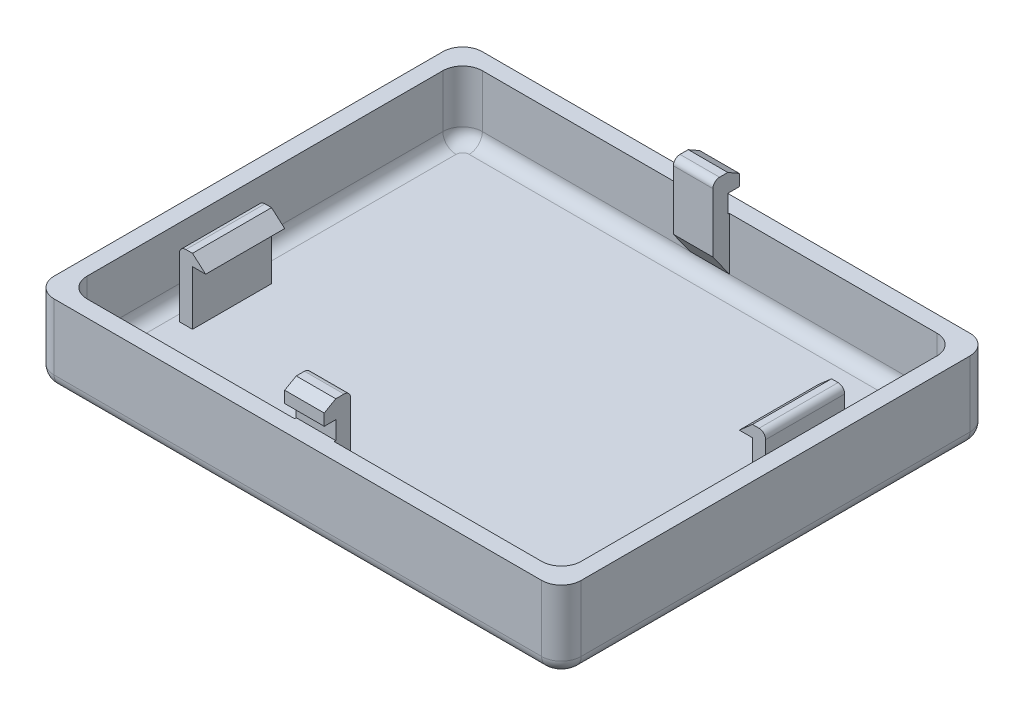
from build123d import *

# Parameters (mm, degrees)
SKETCH1_W            = 80
SKETCH1_H            = 65
BOSS_EXTRUDE1_DEPTH  = 12
SKETCH2_W            = 75
SKETCH2_H            = 60
CUT_EXTRUDE1_DEPTH   = 10
FILLET4_R            = 2
FILLET5_R            = 3
FILLET8_R            = 2
SKETCH5_W            = 6
SKETCH5_H            = 13.5
BOSS_EXTRUDE2_DEPTH  = 2.5
CUT_EXTRUDE3_REACH   = 81.876
SKETCH6_W            = 0.25
SKETCH6_H            = 5.5
BOSS_EXTRUDE3_DEPTH  = 6
CUT_EXTRUDE4_REACH   = 81.876
SKETCH10_W           = 6
SKETCH10_H           = 13.5
BOSS_EXTRUDE4_DEPTH  = 2.5
CUT_EXTRUDE5_REACH   = 81.876
SKETCH11_W           = 0.25
SKETCH11_H           = 5.5
BOSS_EXTRUDE5_DEPTH  = 6
CUT_EXTRUDE6_DEPTH   = 6
SKETCH14_W           = 2
SKETCH14_H           = 12
BOSS_EXTRUDE7_DEPTH  = 10
SKETCH15_W           = 12
SKETCH15_H           = 1.75
BOSS_EXTRUDE8_DEPTH  = 2
SKETCH16_W           = 2
SKETCH16_H           = 12
BOSS_EXTRUDE9_DEPTH  = 10
SKETCH17_W           = 12
SKETCH17_H           = 1.75
BOSS_EXTRUDE10_DEPTH = 2
FILLET9_R            = 1
CUT_EXTRUDE7_REACH   = 97.176
CUT_EXTRUDE8_REACH   = 91.658


with BuildPart() as part:
    # Sketch1 → Boss-Extrude1 (new body)
    with BuildSketch(Plane(origin=(0, 0, 0), x_dir=(1, 0, 0), z_dir=(0, 1, 0))):
        with Locations((40, 32.5)):
            Rectangle(SKETCH1_W, SKETCH1_H)
    extrude(amount=BOSS_EXTRUDE1_DEPTH)

    # Sketch2 → Cut-Extrude1 (cut)
    with BuildSketch(Plane(origin=(0, 12, 0), x_dir=(1, 0, 0), z_dir=(0, 1, 0))):
        with Locations((40, 32.5)):
            Rectangle(SKETCH2_W, SKETCH2_H)
    extrude(amount=-CUT_EXTRUDE1_DEPTH, mode=Mode.SUBTRACT)

    # Fillet4
    fillet4_edges = [part.edges().sort_by_distance(p)[0] for p in [
        (40, 0, -65),
        (80, 0, -32.5),
        (40, 0, 0),
        (0, 0, -32.5),
    ]]
    fillet(fillet4_edges, radius=FILLET4_R)

    # Fillet5
    # the kernel refuses this fillet: 3 mm, written as the material it adds along each edge
    with BuildSketch(Plane(origin=(2.5, 12, -2.5), x_dir=(0, 0, -1), z_dir=(0, -1, 0)), Plane(origin=(77.5, 12, -62.5), x_dir=(0, 0, 1), z_dir=(0, -1, 0)), Plane(origin=(77.5, 12, -2.5), x_dir=(-1, 0, 0), z_dir=(0, -1, 0))) as fillet5_piece_1:
        with BuildLine():
            CenterArc((FILLET5_R, FILLET5_R), FILLET5_R, 180, 90)
            Line((0, FILLET5_R), (0, 0))
            Line((0, 0), (FILLET5_R, 0))
        make_face()
    extrude(amount=10)
    with BuildSketch(Plane(origin=(2.5, 12, -62.5), x_dir=(0, 0, 1), z_dir=(0, -1, 0))) as fillet5_piece_2:
        with BuildLine():
            CenterArc((FILLET5_R, -FILLET5_R), FILLET5_R, 90, 90)
            Line((0, -FILLET5_R), (0, 0))
            Line((0, 0), (FILLET5_R, 0))
        make_face()
    extrude(amount=10)
    # the kernel refuses this fillet: 3 mm, written as the material it takes off along each edge
    with BuildSketch(Plane(origin=(77, 0, -62), x_dir=(0, 0, -1), z_dir=(-1, 0, 0))) as fillet5_2_piece_1:
        with BuildLine():
            CenterArc((1, -2), 2, 0, 90)
            Line((3, -2), (3, 0))
            Line((3, 0), (1, 0))
        make_face()
    revolve(axis=Axis((77, 0, -62), (0, -1, 0)), revolution_arc=90, mode=Mode.SUBTRACT)
    with BuildSketch(Plane(origin=(77, 0, -3), x_dir=(1, 0, 0), z_dir=(0, 0, -1))) as fillet5_2_piece_2:
        with BuildLine():
            CenterArc((1, -2), 2, 0, 90)
            Line((3, -2), (3, 0))
            Line((3, 0), (1, 0))
        make_face()
    revolve(axis=Axis((77, 0, -3), (0, -1, 0)), revolution_arc=90, mode=Mode.SUBTRACT)
    with BuildSketch(Plane(origin=(3, 0, -62), x_dir=(-1, 0, 0), z_dir=(0, 0, 1))) as fillet5_2_piece_3:
        with BuildLine():
            CenterArc((1, -2), 2, 0, 90)
            Line((3, -2), (3, 0))
            Line((3, 0), (1, 0))
        make_face()
    revolve(axis=Axis((3, 0, -62), (0, -1, 0)), revolution_arc=90, mode=Mode.SUBTRACT)
    with BuildSketch(Plane(origin=(3, 0, -3), x_dir=(0, 0, 1), z_dir=(1, 0, 0))) as fillet5_2_piece_4:
        with BuildLine():
            CenterArc((1, -2), 2, 0, 90)
            Line((3, -2), (3, 0))
            Line((3, 0), (1, 0))
        make_face()
    revolve(axis=Axis((3, 0, -3), (0, -1, 0)), revolution_arc=90, mode=Mode.SUBTRACT)
    with BuildSketch(Plane(origin=(0, 0, -65), x_dir=(0, 0, 1), z_dir=(0, 1, 0)), Plane(origin=(0, 0, 0), x_dir=(1, 0, 0), z_dir=(0, 1, 0))) as fillet5_2_piece_5:
        with BuildLine():
            CenterArc((FILLET5_R, FILLET5_R), FILLET5_R, 180, 90)
            Line((0, FILLET5_R), (0, 0))
            Line((0, 0), (FILLET5_R, 0))
        make_face()
    extrude(amount=19.5, mode=Mode.SUBTRACT)
    with BuildSketch(Plane(origin=(80, 0, -65), x_dir=(0, 0, 1), z_dir=(0, 1, 0)), Plane(origin=(80, 0, 0), x_dir=(-1, 0, 0), z_dir=(0, 1, 0))) as fillet5_2_piece_6:
        with BuildLine():
            CenterArc((FILLET5_R, -FILLET5_R), FILLET5_R, 90, 90)
            Line((0, -FILLET5_R), (0, 0))
            Line((0, 0), (FILLET5_R, 0))
        make_face()
    extrude(amount=19.5, mode=Mode.SUBTRACT)

    # Fillet8
    fillet8_edges = [part.edges().sort_by_distance(p)[0] for p in [
        (40, 2, -2.5),
        (2.5, 2, -32.5),
        (77.5, 2, -32.5),
        (40, 2, -62.5),
        (3.378679656, 2, -61.621320344),
        (76.621320344, 2, -61.621320344),
        (76.621320344, 2, -3.378679656),
        (3.378679656, 2, -3.378679656),
    ]]
    fillet(fillet8_edges, radius=FILLET8_R)

    # Sketch5 → Boss-Extrude2 (add)
    with BuildSketch(Plane.XY.offset(-62.5)):
        with Locations((40, 10.75)):
            Rectangle(SKETCH5_W, SKETCH5_H)
    extrude(amount=BOSS_EXTRUDE2_DEPTH)

    # Sketch6 → Cut-Extrude3 (cut, up to next)
    with BuildSketch(Plane(origin=(43, 0, 0), x_dir=(0, 0, -1), z_dir=(1, 0, 0)), mode=Mode.PRIVATE) as cut_extrude3_sk1:
        with Locations((62.375, 14.75)):
            Rectangle(SKETCH6_W, SKETCH6_H)
    cut_extrude3_tool1 = extrude(cut_extrude3_sk1.sketch, amount=-CUT_EXTRUDE3_REACH, mode=Mode.PRIVATE) & part.part
    add(cut_extrude3_tool1.solids().sort_by_distance((43, 14.75, -62.375))[0], mode=Mode.SUBTRACT)

    # Sketch7 → Boss-Extrude3 (add)
    with BuildSketch(Plane(origin=(43, 0, 0), x_dir=(0, 0, -1), z_dir=(1, 0, 0))):
        Polygon((62.25, 14.75), (64, 14.75), (64, 16.5), (62.25, 17.5), align=None)
    extrude(amount=-BOSS_EXTRUDE3_DEPTH)

    # Sketch8 → Cut-Extrude4 (cut, up to next)
    with BuildSketch(Plane(origin=(43, 0, 0), x_dir=(0, 0, -1), z_dir=(1, 0, 0)), mode=Mode.PRIVATE) as cut_extrude4_sk1:
        Polygon((60, 4), (62.5, 4), (60, 7.5), align=None)
    cut_extrude4_tool1 = extrude(cut_extrude4_sk1.sketch, amount=-CUT_EXTRUDE4_REACH, mode=Mode.PRIVATE) & part.part
    add(cut_extrude4_tool1.solids().sort_by_distance((43, 5.166667, -60.833333))[0], mode=Mode.SUBTRACT)

    # Sketch10 → Boss-Extrude4 (add)
    with BuildSketch(Plane(origin=(0, 0, -2.5), x_dir=(-1, 0, 0), z_dir=(0, 0, -1))):
        with Locations((-40, 10.75)):
            Rectangle(SKETCH10_W, SKETCH10_H)
    extrude(amount=BOSS_EXTRUDE4_DEPTH)

    # Sketch11 → Cut-Extrude5 (cut, up to next)
    with BuildSketch(Plane.ZY.offset(-37), mode=Mode.PRIVATE) as cut_extrude5_sk1:
        with Locations((-2.625, 14.75)):
            Rectangle(SKETCH11_W, SKETCH11_H)
    cut_extrude5_tool1 = extrude(cut_extrude5_sk1.sketch, amount=-CUT_EXTRUDE5_REACH, mode=Mode.PRIVATE) & part.part
    add(cut_extrude5_tool1.solids().sort_by_distance((37, 14.75, -2.625))[0], mode=Mode.SUBTRACT)

    # Sketch12 → Boss-Extrude5 (add)
    with BuildSketch(Plane.ZY.offset(-37)):
        Polygon((-2.75, 14.75), (-1, 14.75), (-1, 16.5), (-2.75, 17.5), align=None)
    extrude(amount=-BOSS_EXTRUDE5_DEPTH)

    # Sketch13 → Cut-Extrude6 (cut)
    with BuildSketch(Plane.ZY.offset(-37)):
        Polygon((-5, 4), (-2.5, 4), (-5, 7.5), align=None)
    extrude(amount=-CUT_EXTRUDE6_DEPTH, mode=Mode.SUBTRACT)

    # Sketch14 → Boss-Extrude7 (add)
    with BuildSketch(Plane(origin=(0, 2, 0), x_dir=(1, 0, 0), z_dir=(0, 1, 0))):
        with Locations((6.5, 22.5)):
            Rectangle(SKETCH14_W, SKETCH14_H)
    extrude(amount=BOSS_EXTRUDE7_DEPTH)

    # Sketch15 → Boss-Extrude8 (add)
    with BuildSketch(Plane(origin=(7.5, 0, 0), x_dir=(0, 0, -1), z_dir=(1, 0, 0))):
        with Locations((22.5, 11.125)):
            Rectangle(SKETCH15_W, SKETCH15_H)
    extrude(amount=BOSS_EXTRUDE8_DEPTH)

    # Sketch16 → Boss-Extrude9 (add)
    with BuildSketch(Plane(origin=(0, 2, 0), x_dir=(1, 0, 0), z_dir=(0, 1, 0))):
        with Locations((73.5, 42.5)):
            Rectangle(SKETCH16_W, SKETCH16_H)
    extrude(amount=BOSS_EXTRUDE9_DEPTH)

    # Sketch17 → Boss-Extrude10 (add)
    with BuildSketch(Plane.ZY.offset(-72.5)):
        with Locations((-42.5, 11.125)):
            Rectangle(SKETCH17_W, SKETCH17_H)
    extrude(amount=BOSS_EXTRUDE10_DEPTH)

    # Fillet9
    fillet9_edges = [part.edges().sort_by_distance(p)[0] for p in [
        (40, 17.5, -60),
        (40, 17.5, -5),
        (5.5, 12, -22.5),
        (74.5, 12, -42.5),
    ]]
    fillet(fillet9_edges, radius=FILLET9_R)

    # Sketch18 → Cut-Extrude7 (cut, up to next)
    with BuildSketch(Plane.XY.offset(-16.5), mode=Mode.PRIVATE) as cut_extrude7_sk1:
        Polygon((7.5, 12), (9.5, 10.25), (9.5, 12), align=None)
    cut_extrude7_tool1 = extrude(cut_extrude7_sk1.sketch, amount=-CUT_EXTRUDE7_REACH, mode=Mode.PRIVATE) & part.part
    add(cut_extrude7_tool1.solids().sort_by_distance((8.833333, 11.416667, -16.5))[0], mode=Mode.SUBTRACT)

    # Sketch19 → Cut-Extrude8 (cut, up to next)
    with BuildSketch(Plane.XY.offset(-36.5), mode=Mode.PRIVATE) as cut_extrude8_sk1:
        Polygon((70.5, 10.25), (72.5, 12), (70.5, 12), align=None)
    cut_extrude8_tool1 = extrude(cut_extrude8_sk1.sketch, amount=-CUT_EXTRUDE8_REACH, mode=Mode.PRIVATE) & part.part
    add(cut_extrude8_tool1.solids().sort_by_distance((71.166667, 11.416667, -36.5))[0], mode=Mode.SUBTRACT)


solid = part.part
